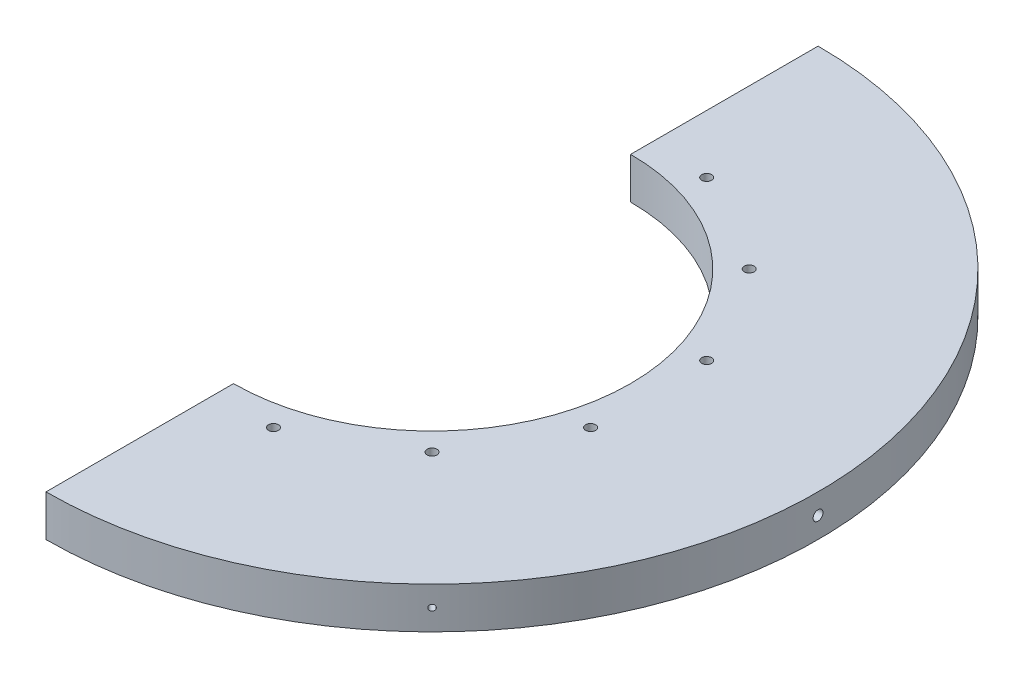
from build123d import *

# Parameters (mm, degrees)
SKETCH1_R               = 88.9
BOSS_EXTRUDE1_DEPTH     = 9.525
SKETCH2_R               = 45.72
CUT_EXTRUDE1_DEPTH      = 12.7
SKETCH3_R               = 1.143
CUT_EXTRUDE2_DEPTH      = 12.7
CUT_EXTRUDE3_DEPTH      = 127.083883288
CUT_EXTRUDE3_DEPTH_BACK = 127.083883288
CIRPATTERN1_COUNT       = 12
SKETCH6_R               = 1.143
CUT_EXTRUDE4_DEPTH      = 25.4
SKETCH7_R               = 0.6985
CUT_EXTRUDE5_DEPTH      = 3.175
CIRPATTERN2_COUNT       = 4


with BuildPart() as part:
    # Sketch1 → Boss-Extrude1 (new body)
    with BuildSketch(Plane(origin=(0, 0, 0), x_dir=(1, 0, 0), z_dir=(0, 1, 0))):
        Circle(SKETCH1_R)
    extrude(amount=BOSS_EXTRUDE1_DEPTH)

    # Sketch2 → Cut-Extrude1 (cut)
    with BuildSketch(Plane(origin=(0, 9.525, 0), x_dir=(1, 0, 0), z_dir=(0, 1, 0))):
        Circle(SKETCH2_R)
    extrude(amount=-CUT_EXTRUDE1_DEPTH, mode=Mode.SUBTRACT)

    # Sketch3 → Cut-Extrude2 (cut)
    with BuildSketch(Plane(origin=(0, 9.525, 0), x_dir=(1, 0, 0), z_dir=(0, 1, 0))):
        with Locations((13.364949615, 49.878671003)):
            Circle(SKETCH3_R)
    cut_extrude2 = extrude(amount=-CUT_EXTRUDE2_DEPTH, mode=Mode.SUBTRACT)

    # Sketch5 → Cut-Extrude3 (cut, two sides: drawn at the far end of the back side and taken through both)
    with BuildSketch(Plane(origin=(0, 9.525, 0), x_dir=(1, 0, 0), z_dir=(0, 1, 0)).offset(-CUT_EXTRUDE3_DEPTH_BACK)):
        Polygon((0, 139.125590331), (0, -130.538836117), (-200.055019192, 4.293377107), align=None)
    extrude(amount=CUT_EXTRUDE3_DEPTH + CUT_EXTRUDE3_DEPTH_BACK, mode=Mode.SUBTRACT)

    # CirPattern1: Cut-Extrude2 ×12 about axis
    cirpattern1_axis = Axis((0, 9.525, 0), (0, 1, 0))
    for i in range(1, CIRPATTERN1_COUNT):
        add(cut_extrude2.rotate(cirpattern1_axis, i * 360 / CIRPATTERN1_COUNT), mode=Mode.SUBTRACT)

    # Sketch6 → Cut-Extrude4 (cut)
    with BuildSketch(Plane(origin=(88.9, 0, 0), x_dir=(0, 0, -1), z_dir=(1, 0, 0))):
        with Locations((0, 4.826)):
            Circle(SKETCH6_R)
    extrude(amount=-CUT_EXTRUDE4_DEPTH, mode=Mode.SUBTRACT)

    # Sketch7 → Cut-Extrude5 (cut)
    with BuildSketch(Plane(origin=(62.861792847, 0, 62.861792847), x_dir=(0, -1, 0), z_dir=(0.7071067811865464, 0, 0.7071067811865488))):
        with Locations((-4.826, 0)):
            Circle(SKETCH7_R)
    cut_extrude5 = extrude(amount=-CUT_EXTRUDE5_DEPTH, mode=Mode.SUBTRACT)

    # CirPattern2: Cut-Extrude5 ×4 about axis
    cirpattern2_axis = Axis((0, 9.525, 0), (0, 1, 0))
    for i in range(1, CIRPATTERN2_COUNT):
        add(cut_extrude5.rotate(cirpattern2_axis, i * 360 / CIRPATTERN2_COUNT), mode=Mode.SUBTRACT)


solid = part.part
